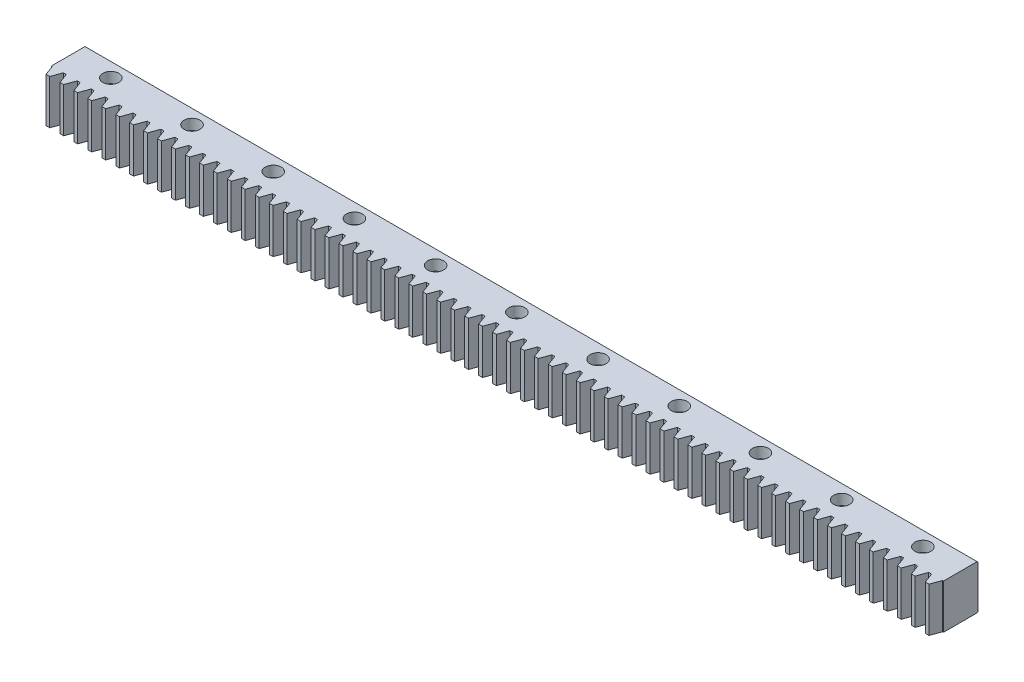
from build123d import *

# Parameters (mm, degrees)
SKETCH_1_W                    = 1004
SKETCH_1_H                    = 50
EXTRUDE_1_DEPTH               = 25
CUT_EXTRUDE_START             = -50
CUT_EXTRUDE_1_DEPTH           = 50
PATTERN_LINEAR_1_COUNT        = 65
PATTERN_LINEAR_1_PITCH        = 15.707963268
CHAMFER_1_SIZE                = 1
HOLE_WIZARD_M10_1_D           = 11
HOLE_WIZARD_M10_1_CBORE_D     = 18
HOLE_WIZARD_M10_1_CBORE_DEPTH = 12
PATTERN_LINEAR_2_COUNT        = 11
PATTERN_LINEAR_2_PITCH        = 91.392


with BuildPart() as part:
    # 草圖1 → 伸長1 (new, symmetric)
    with BuildSketch(Plane(origin=(0, 0, 0), x_dir=(1, 0, 0), z_dir=(0, 1, 0))):
        with Locations((0, -25)):
            Rectangle(SKETCH_1_W, SKETCH_1_H)
    extrude(amount=EXTRUDE_1_DEPTH, both=True)

    # 草圖2 → 除料-伸長1 (cut)
    with BuildSketch(Plane(origin=(0, 25, 0), x_dir=(1, 0, 0), z_dir=(0, 1, 0)).offset(CUT_EXTRUDE_START)):
        Polygon((496.908158012, -50), (501.002823147, -38.75), (504.307176853, -38.75), (508.401841988, -50), align=None)
    cut_extrude_1 = extrude(amount=CUT_EXTRUDE_1_DEPTH, mode=Mode.SUBTRACT)

    # 直線複製排列1: 除料-伸長1 ×65
    with Locations(*[(-i * PATTERN_LINEAR_1_PITCH, 0, 0) for i in range(1, PATTERN_LINEAR_1_COUNT)]):
        add(cut_extrude_1, mode=Mode.SUBTRACT)

    # 導角1
    chamfer_1_edges = [part.edges().sort_by_distance(p)[0] for p in [
        (0, 25, 0),
        (0, -25, 0),
    ]]
    chamfer(chamfer_1_edges, length=CHAMFER_1_SIZE)

    # M10 六角承窩頭蓋螺釘的柱孔1 (through all)
    with Locations(Plane(origin=(0, 25, 0), x_dir=(-1, 0, 0), z_dir=(0, 1, 0))):
        with Locations((456.96, 17)):
            hole_wizard_m10_1 = CounterBoreHole(HOLE_WIZARD_M10_1_D / 2, HOLE_WIZARD_M10_1_CBORE_D / 2, HOLE_WIZARD_M10_1_CBORE_DEPTH)

    # 直線複製排列2: M10 六角承窩頭蓋螺釘的柱孔1 ×11
    with Locations(*[(i * PATTERN_LINEAR_2_PITCH, 0, 0) for i in range(1, PATTERN_LINEAR_2_COUNT)]):
        add(hole_wizard_m10_1, mode=Mode.SUBTRACT)


solid = part.part
